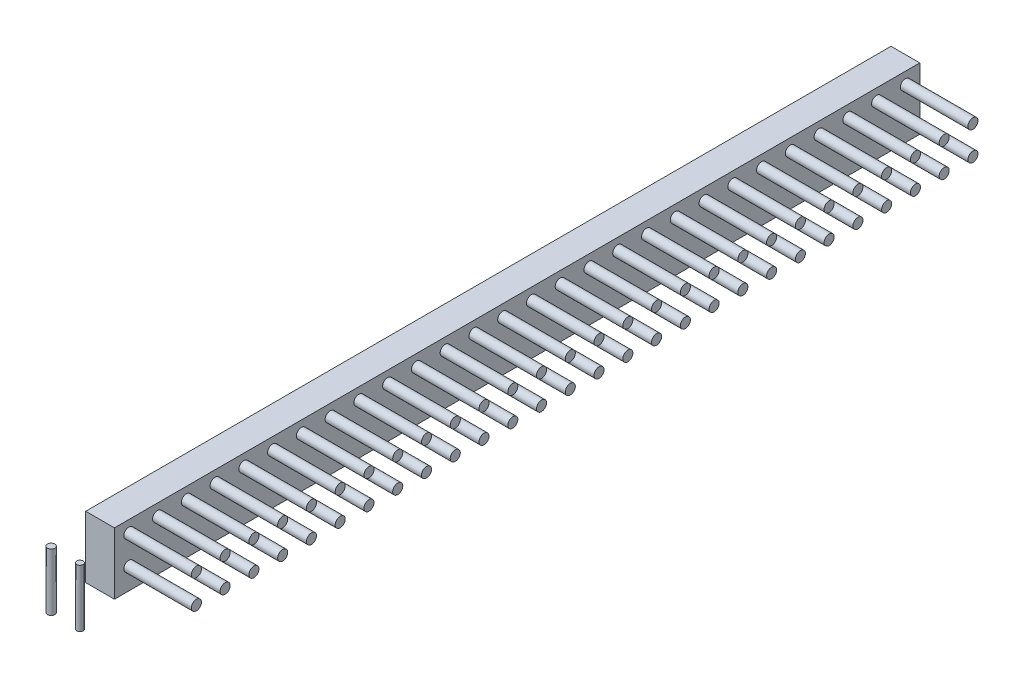
from build123d import *

# Parameters (mm, degrees)
SKETCH1_W             = 2.54
SKETCH1_H             = 5.461
EXTRUDE1_DEPTH        = 2.54
SKETCH2_R             = 0.4445
EXTRUDE2_DEPTH        = 5.969
SKETCH3_R             = 0.27890811
EXTRUDE3_DEPTH        = 5.08
SKETCH3_R_2           = 0.322946233
EXTRUDE3_2_DEPTH      = 5.08
LPATTERN1_OUTLINE_W   = 5.461
LPATTERN1_OUTLINE_H   = 68.58
LPATTERN1_DEPTH       = 2.54
LPATTERN1_START       = 2.54
LPATTERN1_2_OUTLINE_R = 0.4445
LPATTERN1_2_DEPTH     = 5.969


# Read off the part's stored shape, not the designer's step: LPattern1
with BuildPart() as part:
    # Sketch1 → Extrude1 (new body)
    with BuildSketch(Plane.XY):
        with Locations((1.27, -2.7305)):
            Rectangle(SKETCH1_W, SKETCH1_H)
    extrude(amount=EXTRUDE1_DEPTH)

    # Sketch2 → Extrude2 (add)
    with BuildSketch(Plane(origin=(2.54, 0, 0), x_dir=(0, 0, -1), z_dir=(1, 0, 0))):
        with Locations(Location((-1.27, -3.556, 0), (0, 0, 270))):
            Circle(SKETCH2_R)
        with Locations(Location((-1.27, -1.016, 0), (0, 0, 270))):
            Circle(SKETCH2_R)
    extrude(amount=EXTRUDE2_DEPTH)

    # LPattern1 outline → LPattern1 (add)
    with BuildSketch(Plane.YZ):
        with Locations((-2.7305, -34.29)):
            Rectangle(LPATTERN1_OUTLINE_W, LPATTERN1_OUTLINE_H)
    extrude(amount=LPATTERN1_DEPTH)

    # LPattern1 2 outline → LPattern1 2 (add)
    with BuildSketch(Plane.YZ.offset(LPATTERN1_START)):
        with Locations((-3.556, -1.27)):
            Circle(LPATTERN1_2_OUTLINE_R)
        with Locations((-1.016, -1.27)):
            Circle(LPATTERN1_2_OUTLINE_R)
        with Locations((-3.556, -3.81)):
            Circle(LPATTERN1_2_OUTLINE_R)
        with Locations((-1.016, -3.81)):
            Circle(LPATTERN1_2_OUTLINE_R)
        with Locations((-3.556, -6.35)):
            Circle(LPATTERN1_2_OUTLINE_R)
        with Locations((-1.016, -6.35)):
            Circle(LPATTERN1_2_OUTLINE_R)
        with Locations((-3.556, -8.89)):
            Circle(LPATTERN1_2_OUTLINE_R)
        with Locations((-1.016, -8.89)):
            Circle(LPATTERN1_2_OUTLINE_R)
        with Locations((-3.556, -11.43)):
            Circle(LPATTERN1_2_OUTLINE_R)
        with Locations((-1.016, -11.43)):
            Circle(LPATTERN1_2_OUTLINE_R)
        with Locations((-3.556, -13.97)):
            Circle(LPATTERN1_2_OUTLINE_R)
        with Locations((-1.016, -13.97)):
            Circle(LPATTERN1_2_OUTLINE_R)
        with Locations((-3.556, -16.51)):
            Circle(LPATTERN1_2_OUTLINE_R)
        with Locations((-1.016, -16.51)):
            Circle(LPATTERN1_2_OUTLINE_R)
        with Locations((-3.556, -19.05)):
            Circle(LPATTERN1_2_OUTLINE_R)
        with Locations((-1.016, -19.05)):
            Circle(LPATTERN1_2_OUTLINE_R)
        with Locations((-3.556, -21.59)):
            Circle(LPATTERN1_2_OUTLINE_R)
        with Locations((-1.016, -21.59)):
            Circle(LPATTERN1_2_OUTLINE_R)
        with Locations((-3.556, -24.13)):
            Circle(LPATTERN1_2_OUTLINE_R)
        with Locations((-1.016, -24.13)):
            Circle(LPATTERN1_2_OUTLINE_R)
        with Locations((-3.556, -26.67)):
            Circle(LPATTERN1_2_OUTLINE_R)
        with Locations((-1.016, -26.67)):
            Circle(LPATTERN1_2_OUTLINE_R)
        with Locations((-3.556, -29.21)):
            Circle(LPATTERN1_2_OUTLINE_R)
        with Locations((-1.016, -29.21)):
            Circle(LPATTERN1_2_OUTLINE_R)
        with Locations((-3.556, -31.75)):
            Circle(LPATTERN1_2_OUTLINE_R)
        with Locations((-1.016, -31.75)):
            Circle(LPATTERN1_2_OUTLINE_R)
        with Locations((-3.556, -34.29)):
            Circle(LPATTERN1_2_OUTLINE_R)
        with Locations((-1.016, -34.29)):
            Circle(LPATTERN1_2_OUTLINE_R)
        with Locations((-3.556, -36.83)):
            Circle(LPATTERN1_2_OUTLINE_R)
        with Locations((-1.016, -36.83)):
            Circle(LPATTERN1_2_OUTLINE_R)
        with Locations((-3.556, -39.37)):
            Circle(LPATTERN1_2_OUTLINE_R)
        with Locations((-1.016, -39.37)):
            Circle(LPATTERN1_2_OUTLINE_R)
        with Locations((-3.556, -41.91)):
            Circle(LPATTERN1_2_OUTLINE_R)
        with Locations((-1.016, -41.91)):
            Circle(LPATTERN1_2_OUTLINE_R)
        with Locations((-3.556, -44.45)):
            Circle(LPATTERN1_2_OUTLINE_R)
        with Locations((-1.016, -44.45)):
            Circle(LPATTERN1_2_OUTLINE_R)
        with Locations((-3.556, -46.99)):
            Circle(LPATTERN1_2_OUTLINE_R)
        with Locations((-1.016, -46.99)):
            Circle(LPATTERN1_2_OUTLINE_R)
        with Locations((-3.556, -49.53)):
            Circle(LPATTERN1_2_OUTLINE_R)
        with Locations((-1.016, -49.53)):
            Circle(LPATTERN1_2_OUTLINE_R)
        with Locations((-3.556, -52.07)):
            Circle(LPATTERN1_2_OUTLINE_R)
        with Locations((-1.016, -52.07)):
            Circle(LPATTERN1_2_OUTLINE_R)
        with Locations((-3.556, -54.61)):
            Circle(LPATTERN1_2_OUTLINE_R)
        with Locations((-1.016, -54.61)):
            Circle(LPATTERN1_2_OUTLINE_R)
        with Locations((-3.556, -57.15)):
            Circle(LPATTERN1_2_OUTLINE_R)
        with Locations((-1.016, -57.15)):
            Circle(LPATTERN1_2_OUTLINE_R)
        with Locations((-3.556, -59.69)):
            Circle(LPATTERN1_2_OUTLINE_R)
        with Locations((-1.016, -59.69)):
            Circle(LPATTERN1_2_OUTLINE_R)
        with Locations((-3.556, -62.23)):
            Circle(LPATTERN1_2_OUTLINE_R)
        with Locations((-1.016, -62.23)):
            Circle(LPATTERN1_2_OUTLINE_R)
        with Locations((-3.556, -64.77)):
            Circle(LPATTERN1_2_OUTLINE_R)
        with Locations((-1.016, -64.77)):
            Circle(LPATTERN1_2_OUTLINE_R)
        with Locations((-3.556, -67.31)):
            Circle(LPATTERN1_2_OUTLINE_R)
        with Locations((-1.016, -67.31)):
            Circle(LPATTERN1_2_OUTLINE_R)
    extrude(amount=LPATTERN1_2_DEPTH)


with BuildPart() as body_2:
    # Sketch3 → Extrude3 (new body)
    with BuildSketch(Plane.XZ.offset(5.461)):
        with Locations((-1.778, 1.27)):
            Circle(SKETCH3_R)
    extrude(amount=EXTRUDE3_DEPTH)


with BuildPart() as body_3:
    # Sketch3 → Extrude3 2 (new body)
    with BuildSketch(Plane.XZ.offset(5.461)):
        with Locations((-4.318, 1.27)):
            Circle(SKETCH3_R_2)
    extrude(amount=EXTRUDE3_2_DEPTH)


solid = Compound([part.part, body_2.part, body_3.part])
